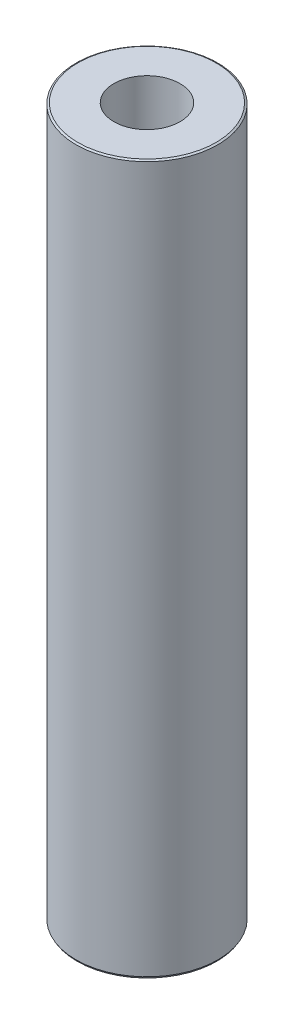
from build123d import *
from OCP.BRepFilletAPI import BRepFilletAPI_MakeChamfer

# Parameters (mm, degrees)
SKETCH1_R           = 60
BOSS_EXTRUDE1_DEPTH = 600
SKETCH2_R           = 28.003012221
CUT_EXTRUDE1_DEPTH  = 606.970296302
CHAMFER1_SIZE       = 0.887861966
CHAMFER1_SIZE2      = 1.537822036


with BuildPart() as part:
    # Sketch1 → Boss-Extrude1 (new body)
    with BuildSketch(Plane(origin=(0, 0, 0), x_dir=(1, 0, 0), z_dir=(0, 1, 0))):
        Circle(SKETCH1_R)
    extrude(amount=BOSS_EXTRUDE1_DEPTH)

    # Sketch2 → Cut-Extrude1 (cut, through all)
    with BuildSketch(Plane(origin=(0, 0, 0), x_dir=(1, 0, 0), z_dir=(0, 1, 0))):
        Circle(SKETCH2_R)
    extrude(amount=CUT_EXTRUDE1_DEPTH, mode=Mode.SUBTRACT)

    # Chamfer1: one chamfer whose edges measure the first distance from different faces: ONE call of the kernel's chamfer builder (chamfer() names one face for all edges)
    chamfer1_edges_1 = [part.edges().sort_by_distance(p)[0] for p in [
        (-60, 600, 0),
    ]]
    chamfer1_side_1 = [part.faces().sort_by_distance(p)[0] for p in [
        (-60, 300, 0),
    ]]
    chamfer1_edges_2 = [part.edges().sort_by_distance(p)[0] for p in [
        (-60, 0, 0),
    ]]
    chamfer1_side_2 = [part.faces().sort_by_distance(p)[0] for p in [
        (-58.302943725, 0, 0),
    ]]
    chamfer1 = BRepFilletAPI_MakeChamfer(part.part.solid().wrapped)
    for e in chamfer1_edges_1:
        chamfer1.Add(CHAMFER1_SIZE, CHAMFER1_SIZE2, e.wrapped, chamfer1_side_1[0].wrapped)  # the first distance lies on this face
    for e in chamfer1_edges_2:
        chamfer1.Add(CHAMFER1_SIZE, CHAMFER1_SIZE2, e.wrapped, chamfer1_side_2[0].wrapped)  # the first distance lies on this face
    add(Compound.cast(chamfer1.Shape()), mode=Mode.REPLACE)


solid = part.part
